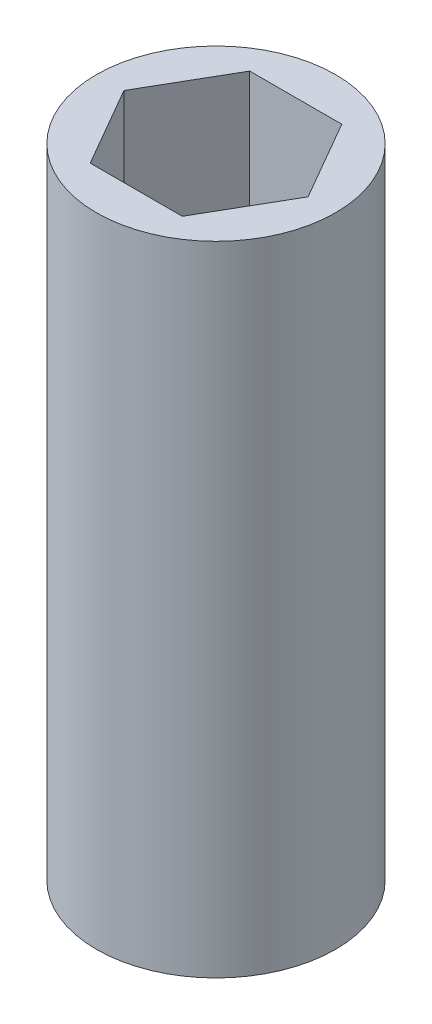
from build123d import *

# Parameters (mm, degrees)
SKETCH1_R           = 9.525
BOSS_EXTRUDE1_DEPTH = 50.8


with BuildPart() as part:
    # Sketch1 → Boss-Extrude1 (new body)
    with BuildSketch(Plane(origin=(0, 0, 0), x_dir=(1, 0, 0), z_dir=(0, 1, 0))):
        Circle(SKETCH1_R)
        Polygon((3.666174209, 6.35), (-3.666174209, 6.35), (-7.332348419, 0), (-3.666174209, -6.35), (3.666174209, -6.35), (7.332348419, 0), align=None, mode=Mode.SUBTRACT)
    extrude(amount=BOSS_EXTRUDE1_DEPTH)


solid = part.part
